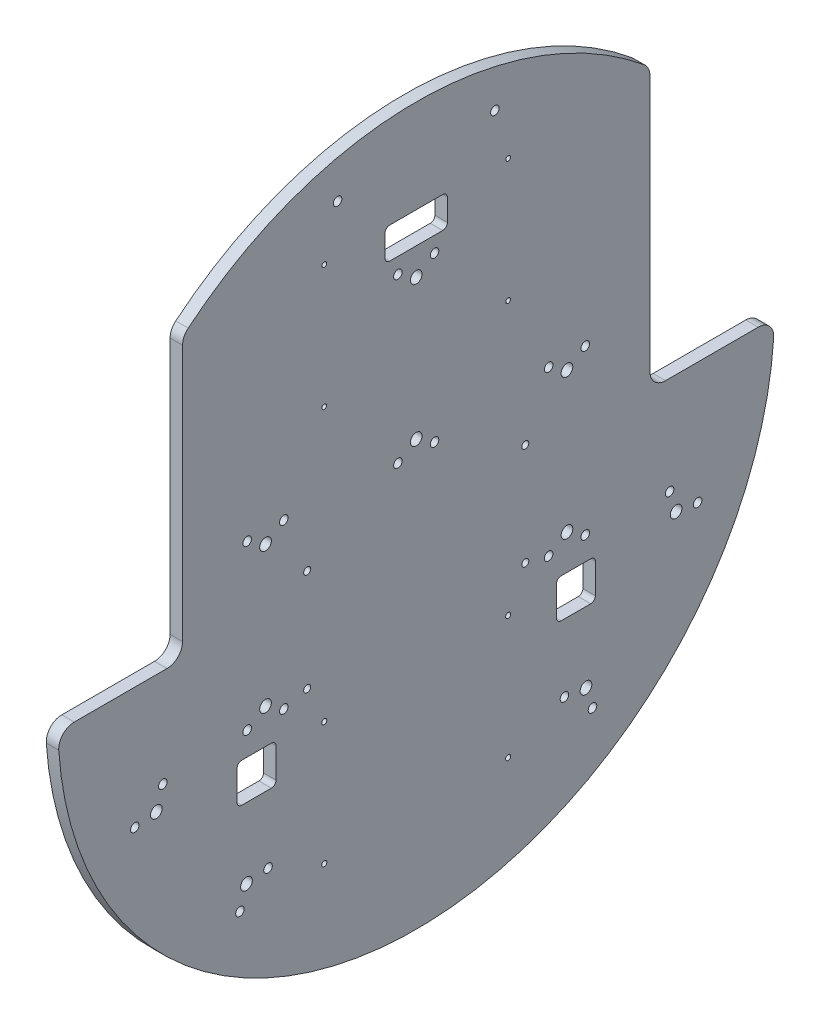
from build123d import *

# Parameters (mm, degrees)
SKETCH_1_R          = 230
EXTRUDE_1_DEPTH     = 8
SKETCH_3_W          = 80
SKETCH_3_H          = 200
CUT_EXTRUDE_1_DEPTH = 10
SKETCH_4_R          = 3.75
SKETCH_4_R_2        = 2.75
CUT_EXTRUDE_2_DEPTH = 10
SKETCH_6_W          = 40
SKETCH_6_H          = 20
SKETCH_6_W_2        = 25
SKETCH_6_H_2        = 25
CUT_EXTRUDE_4_DEPTH = 10
FILLET_2_R          = 10
FILLET_3_R          = 10
FILLET_4_R          = 10
SKETCH_7_R          = 2.75
SKETCH_7_R_2        = 3.75
CUT_EXTRUDE_5_DEPTH = 10
SKETCH_8_R          = 1.5
CUT_EXTRUDE_6_DEPTH = 326.005785815
SKETCH_9_R          = 2.25
CUT_EXTRUDE_7_DEPTH = 11
FILLET_5_R          = 3
SKETCH_10_R         = 1.65
CUT_EXTRUDE_8_DEPTH = 10
SKETCH_11_R         = 2.75
CUT_EXTRUDE_9_DEPTH = 10


with BuildPart() as part:
    # 草图1 → 凸台-拉伸1 (new body)
    with BuildSketch(Plane(origin=(0, 0, 0), x_dir=(0, 0, -1), z_dir=(1, 0, 0))):
        Circle(SKETCH_1_R)
    extrude(amount=EXTRUDE_1_DEPTH)

    # 草图3 → 切除-拉伸1 (cut)
    with BuildSketch(Plane(origin=(8, 0, 0), x_dir=(0, 0, -1), z_dir=(1, 0, 0))):
        with Locations((190, 95)):
            Rectangle(SKETCH_3_W, SKETCH_3_H)
        with Locations((-190, 95)):
            Rectangle(SKETCH_3_W, SKETCH_3_H)
    extrude(amount=-CUT_EXTRUDE_1_DEPTH, mode=Mode.SUBTRACT)

    # 草图4 → 切除-拉伸2 (cut)
    with BuildSketch(Plane(origin=(8, 0, 0), x_dir=(0, 0, -1), z_dir=(1, 0, 0))):
        with Locations((166.813442197, -81.229769803)):
            Circle(SKETCH_4_R)
        with Locations((108.962557326, -150.173769684)):
            Circle(SKETCH_4_R)
        with Locations((-108.962557326, -150.173769684)):
            Circle(SKETCH_4_R)
        with Locations((-166.813442197, -81.229769803)):
            Circle(SKETCH_4_R)
        with Locations((-11.75, 35)):
            Circle(SKETCH_4_R_2)
        with Locations((11.75, 35)):
            Circle(SKETCH_4_R_2)
        with Locations((180.635371477, -83.037190894)):
            Circle(SKETCH_4_R_2)
        with Locations((113.14267246, -163.471857421)):
            Circle(SKETCH_4_R_2)
        with Locations((162.633327063, -67.931682066)):
            Circle(SKETCH_4_R_2)
        with Locations((95.140628046, -148.366348594)):
            Circle(SKETCH_4_R_2)
        with Locations((-162.633327063, -67.931682066)):
            Circle(SKETCH_4_R_2)
        with Locations((-180.635371477, -83.037190894)):
            Circle(SKETCH_4_R_2)
        with Locations((-95.140628046, -148.366348594)):
            Circle(SKETCH_4_R_2)
        with Locations((-113.14267246, -163.471857421)):
            Circle(SKETCH_4_R_2)
        with Locations((11.75, 140)):
            Circle(SKETCH_4_R_2)
        with Locations((-11.75, 140)):
            Circle(SKETCH_4_R_2)
        with Locations((0, 132.5)):
            Circle(SKETCH_4_R)
        with Locations((0, 42.5)):
            Circle(SKETCH_4_R)
    extrude(amount=-CUT_EXTRUDE_2_DEPTH, mode=Mode.SUBTRACT)

    # 草图6 → 切除-拉伸4 (cut)
    with BuildSketch(Plane(origin=(8, 0, 0), x_dir=(0, 0, -1), z_dir=(1, 0, 0))):
        with Locations((0, 160)):
            Rectangle(SKETCH_6_W, SKETCH_6_H)
        with Locations((-102.5, -92.5)):
            Rectangle(SKETCH_6_W_2, SKETCH_6_H_2)
        with Locations((102.5, -92.5)):
            Rectangle(SKETCH_6_W_2, SKETCH_6_H_2)
    extrude(amount=-CUT_EXTRUDE_4_DEPTH, mode=Mode.SUBTRACT)

    # 圆角2
    fillet_2_edges = [part.edges().sort_by_distance(p)[0] for p in [
        (4, -5, 229.945645751),
    ]]
    fillet(fillet_2_edges, radius=FILLET_2_R)

    # 圆角3
    fillet_3_edges = [part.edges().sort_by_distance(p)[0] for p in [
        (4, 174.355957742, 150),
        (4, 174.355957742, -150),
        (4, -5, -229.945645751),
    ]]
    fillet(fillet_3_edges, radius=FILLET_3_R)

    # 圆角4
    fillet_4_edges = [part.edges().sort_by_distance(p)[0] for p in [
        (4, -5, -150),
        (4, -5, 150),
    ]]
    fillet(fillet_4_edges, radius=FILLET_4_R)

    # 草图7 → 切除-拉伸5 (cut)
    with BuildSketch(Plane(origin=(8, 0, 0), x_dir=(0, 0, -1), z_dir=(1, 0, 0))):
        with Locations((85, 40)):
            Circle(SKETCH_7_R)
        with Locations((108.5, 40)):
            Circle(SKETCH_7_R)
        with Locations((85, -65)):
            Circle(SKETCH_7_R)
        with Locations((108.5, -65)):
            Circle(SKETCH_7_R)
        with Locations((96.75, 32.5)):
            Circle(SKETCH_7_R_2)
        with Locations((96.75, -57.5)):
            Circle(SKETCH_7_R_2)
        with Locations((-96.75, -57.5)):
            Circle(SKETCH_7_R_2)
        with Locations((-96.75, 32.5)):
            Circle(SKETCH_7_R_2)
        with Locations((-108.5, -65)):
            Circle(SKETCH_7_R)
        with Locations((-85, -65)):
            Circle(SKETCH_7_R)
        with Locations((-108.5, 40)):
            Circle(SKETCH_7_R)
        with Locations((-85, 40)):
            Circle(SKETCH_7_R)
    extrude(amount=-CUT_EXTRUDE_5_DEPTH, mode=Mode.SUBTRACT)

    # 草图8 → 切除-拉伸6 (cut, through all)
    with BuildSketch(Plane(origin=(8, 0, 0), x_dir=(0, 0, -1), z_dir=(1, 0, 0))):
        with Locations((-59, 169)):
            Circle(SKETCH_8_R)
        with Locations((-59, 90)):
            Circle(SKETCH_8_R)
        with Locations((59, 169)):
            Circle(SKETCH_8_R)
        with Locations((59, 90)):
            Circle(SKETCH_8_R)
    extrude(amount=-CUT_EXTRUDE_6_DEPTH, mode=Mode.SUBTRACT)

    # 草图9 → 切除-拉伸7 (cut)
    with BuildSketch(Plane(origin=(8, 0, 0), x_dir=(0, 0, -1), z_dir=(1, 0, 0))):
        with Locations((70, 4.25)):
            Circle(SKETCH_9_R)
        with Locations((70, -61.25)):
            Circle(SKETCH_9_R)
        with Locations((-70, 4.25)):
            Circle(SKETCH_9_R)
        with Locations((-70, -61.25)):
            Circle(SKETCH_9_R)
    extrude(amount=-CUT_EXTRUDE_7_DEPTH, mode=Mode.SUBTRACT)

    # 圆角5
    fillet_5_edges = [part.edges().sort_by_distance(p)[0] for p in [
        (4, 170, -20),
        (4, 150, -20),
        (4, 150, 20),
        (4, 170, 20),
        (4, -80, -90),
        (4, -105, -90),
        (4, -105, -115),
        (4, -80, -115),
        (4, -80, 115),
        (4, -105, 115),
        (4, -105, 90),
        (4, -80, 90),
    ]]
    fillet(fillet_5_edges, radius=FILLET_5_R)

    # 草图10 → 切除-拉伸8 (cut)
    with BuildSketch(Plane(origin=(8, 0, 0), x_dir=(0, 0, -1), z_dir=(1, 0, 0))):
        with Locations((-59, -85)):
            Circle(SKETCH_10_R)
        with Locations((59, -85)):
            Circle(SKETCH_10_R)
        with Locations((59, -164)):
            Circle(SKETCH_10_R)
        with Locations((-59, -164)):
            Circle(SKETCH_10_R)
    extrude(amount=-CUT_EXTRUDE_8_DEPTH, mode=Mode.SUBTRACT)

    # 草图11 → 切除-拉伸9 (cut)
    with BuildSketch(Plane(origin=(8, 0, 0), x_dir=(0, 0, -1), z_dir=(1, 0, 0))):
        with Locations((50.5, 200)):
            Circle(SKETCH_11_R)
        with Locations((-50.5, 200)):
            Circle(SKETCH_11_R)
    extrude(amount=-CUT_EXTRUDE_9_DEPTH, mode=Mode.SUBTRACT)


solid = part.part
